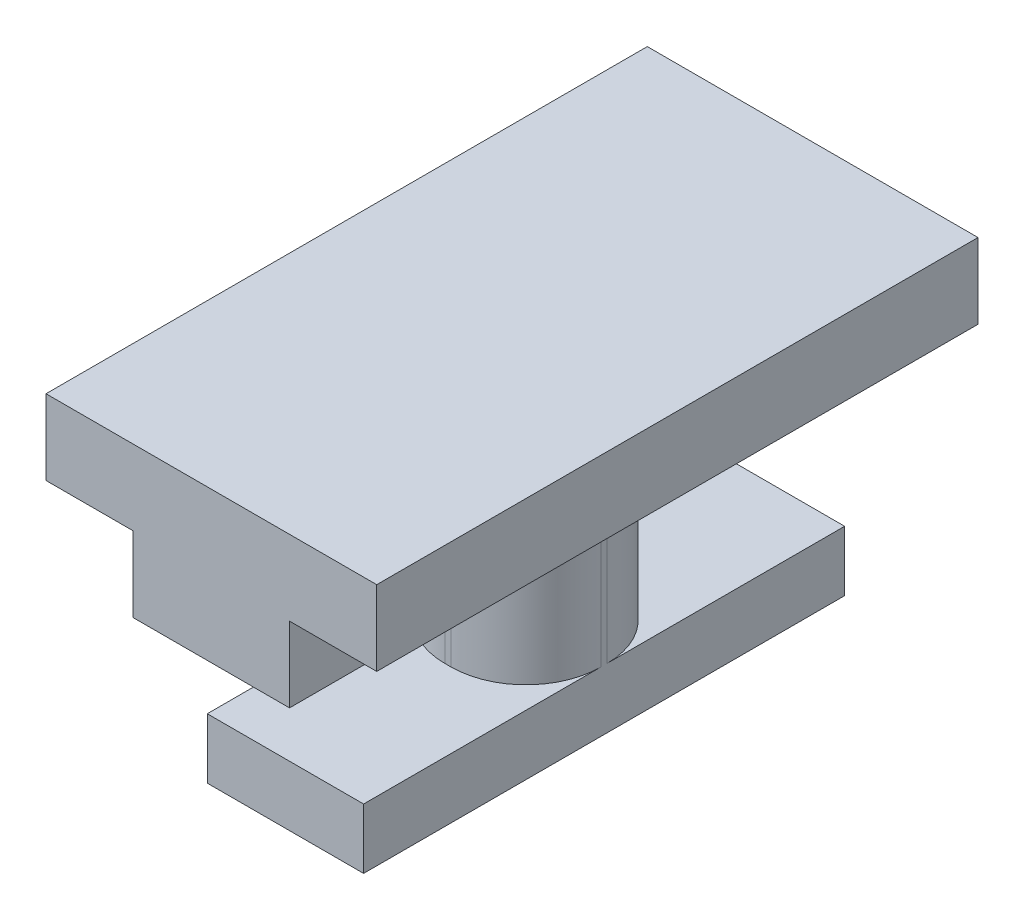
from build123d import *

# Parameters (mm, degrees)
SALIENTE_EXTRUIR1_DEPTH = 20
CROQUIS2_W              = 5.2
CROQUIS2_H              = 5.2
SALIENTE_EXTRUIR2_DEPTH = 4
CROQUIS3_W              = 5.2
CROQUIS3_H              = 16
SALIENTE_EXTRUIR4_DEPTH = 2
REDONDEO4_R             = 2.5


with BuildPart() as part:
    # Croquis1 → Saliente-Extruir1 (new body)
    with BuildSketch(Plane.XY):
        Polygon((-5.5, 0), (5.5, 0), (5.5, -2.5), (2.6, -2.5), (2.6, -5), (-2.6, -5), (-2.6, -2.5), (-5.5, -2.5), align=None)
    extrude(amount=SALIENTE_EXTRUIR1_DEPTH)

    # Croquis2 → Saliente-Extruir2 (add)
    with BuildSketch(Plane.XZ.offset(5)):
        with Locations((0, 9.535930778)):
            Rectangle(CROQUIS2_W, CROQUIS2_H)
    extrude(amount=SALIENTE_EXTRUIR2_DEPTH)

    # Croquis3 → Saliente-Extruir4 (add)
    with BuildSketch(Plane.XZ.offset(9)):
        with Locations((0, 9.535930778)):
            Rectangle(CROQUIS3_W, CROQUIS3_H)
    extrude(amount=SALIENTE_EXTRUIR4_DEPTH)

    # Redondeo4
    redondeo4_edges = [part.edges().sort_by_distance(p)[0] for p in [
        (-2.6, -7, 12.135930778),
        (-2.6, -7, 6.935930778),
        (2.6, -7, 12.135930778),
        (2.6, -7, 6.935930778),
    ]]
    fillet(redondeo4_edges, radius=REDONDEO4_R)


solid = part.part
